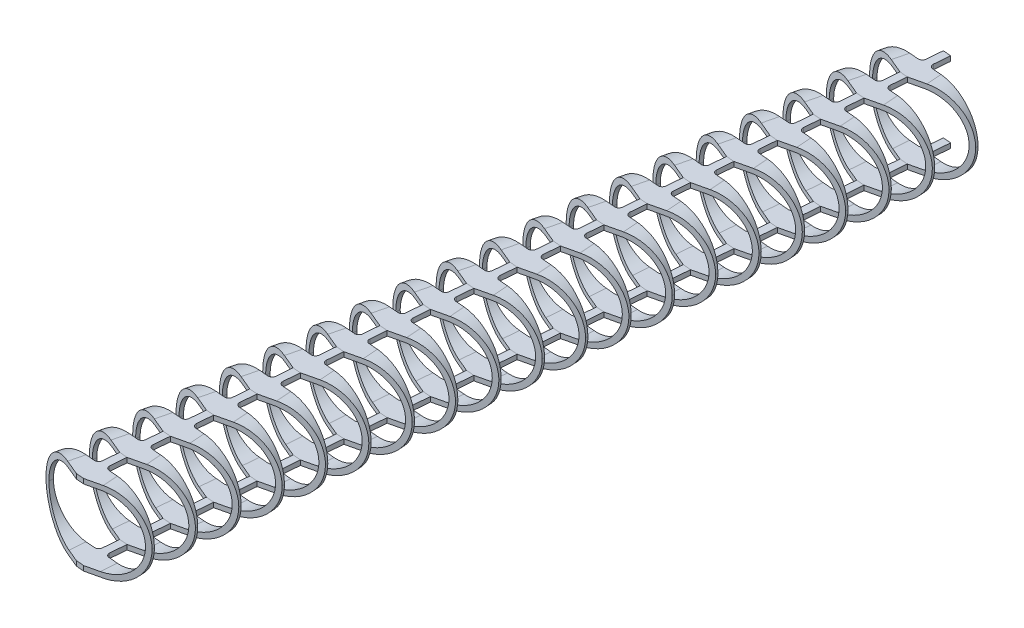
from build123d import *

# Parameters (mm, degrees)
BOSS_EXTRUDE2_DEPTH     = 100
FILLET1_R               = 50
FILLET2_R               = 5
CUT_EXTRUDE3_DEPTH      = 47
CUT_EXTRUDE3_DEPTH_BACK = 47


with BuildPart() as part:
    # Sketch1 → Boss-Extrude2 (new body)
    with BuildSketch(Plane(origin=(0, 0, 0), x_dir=(1, 0, 0), z_dir=(0, 1, 0))):
        Polygon((9.964685044, -0.839673725), (76.670367786, -6.460625001), (78.769552099, 18.45108761), (88.734237144, 17.611413885), (86.635052831, -7.300298727), (153.340735572, -12.921250003), (153.568968522, -16.041603582), (84.535868518, -32.212011338), (74.571183473, -31.372337613), (9.217505194, -3.87783419), align=None)
    extrude(amount=BOSS_EXTRUDE2_DEPTH)

    # Fillet1
    fillet1_edges = [part.edges().sort_by_distance(p)[0] for p in [
        (9.591095119, 100, 2.358753958),
        (9.591095119, 0, 2.358753958),
        (153.454852047, 0, 14.481426793),
        (153.454852047, 100, 14.481426793),
    ]]
    fillet(fillet1_edges, radius=FILLET1_R - 0.0001)  # a hair under: the kernel refuses the full size

    # Fillet2
    fillet2_edges = [part.edges().sort_by_distance(p)[0] for p in [
        (76.670367786, 50, 6.460625001),
        (86.635052831, 50, 7.300298727),
    ]]
    fillet(fillet2_edges, radius=FILLET2_R)

    # Sketch8 → Cut-Extrude3 (cut, two sides: drawn at the far end of the back side and taken through both)
    with BuildSketch(Plane(origin=(0, 0, 0), x_dir=(-0.9964685044458976, 0, -0.08396737251668822), z_dir=(0.0839673725166882, 0, -0.9964685044458975)).offset(-CUT_EXTRUDE3_DEPTH_BACK)):
        with BuildLine():
            Line((-97.942088429, 94), (-65.942088429, 94))
            Line((-65.942088429, 94), (-60.623256289, 94))
            add(Edge.make_bspline(
                [(-16, 50), (-16, 52.926041492), (-16.293067937, 55.802030794), (-17.153624772, 60.044121121), (-17.511165893, 61.446078496), (-18.155902612, 63.530496972), (-18.389598153, 64.224018155), (-18.89054481, 65.595442894), (-19.15724227, 66.272166778), (-20.570151831, 69.611784713), (-21.952353975, 72.143935669), (-23.991520358, 75.136595088), (-24.415065615, 75.726422228), (-25.294070354, 76.888395404), (-25.750621275, 77.461733141), (-27.154310816, 79.137437732), (-28.138647508, 80.200426953), (-31.232731054, 83.232036697), (-33.482219407, 85.044785033), (-36.53303245, 87.044184988), (-37.15508803, 87.43036015), (-38.409747221, 88.167493523), (-39.044010137, 88.519572374), (-40.967234395, 89.527212102), (-43.585932722, 90.74136702), (-46.31195503, 91.700299315), (-48.397318656, 92.322362259), (-49.099259648, 92.513498737), (-50.517032852, 92.862737564), (-51.231324108, 93.020379348), (-54.806133867, 93.719143346), (-57.698352456, 94), (-60.623256289, 94)],
                knots=[0, 0, 0, 0, 0.125, 0.125, 0.1875, 0.1875, 0.21875, 0.21875, 0.25, 0.25, 0.375, 0.375, 0.40625, 0.40625, 0.4375, 0.4375, 0.5, 0.5, 0.625, 0.625, 0.65625, 0.65625, 0.6875, 0.6875, 0.75, 0.8125, 0.8125, 0.84375, 0.84375, 0.875, 0.875, 1, 1, 1, 1], degree=3))
            add(Edge.make_bspline(
                [(-60.623256289, 6), (-57.697653963, 6), (-54.819774011, 6.280957922), (-50.571712744, 7.107200549), (-49.167235868, 7.450575557), (-46.381898734, 8.276364681), (-44.995554299, 8.761617774), (-40.957462182, 10.399299216), (-38.401578358, 11.736658457), (-34.770494916, 14.108306321), (-33.594157499, 14.960211244), (-31.312283198, 16.791697026), (-30.225902675, 17.755922661), (-27.126031935, 20.788869475), (-25.269968029, 22.996804785), (-22.809034218, 26.594189737), (-22.040725002, 27.846719473), (-20.647404803, 30.395192674), (-19.388758044, 32.997690333), (-18.394818823, 35.706375828), (-17.749793917, 37.778177403), (-17.551553624, 38.47550444), (-17.189179053, 39.883840196), (-17.024785307, 40.596154358), (-16.293253429, 44.177391354), (-16, 47.073212333), (-16, 50)],
                knots=[0, 0, 0, 0, 0.125, 0.125, 0.1875, 0.1875, 0.25, 0.25, 0.375, 0.375, 0.4375, 0.4375, 0.5, 0.5, 0.625, 0.625, 0.6875, 0.6875, 0.75, 0.8125, 0.8125, 0.84375, 0.84375, 0.875, 0.875, 1, 1, 1, 1], degree=3))
            Line((-60.623256289, 6), (-65.942088429, 6))
            Line((-65.942088429, 6), (-97.942088429, 6))
            Line((-97.942088429, 6), (-103.260920569, 6))
            add(Edge.make_bspline(
                [(-147.884176859, 50), (-147.884176859, 47.073958508), (-147.591108922, 44.197969206), (-146.730552087, 39.955878879), (-146.373010966, 38.553921504), (-145.728274247, 36.469503028), (-145.494578705, 35.775981845), (-144.993632048, 34.404557106), (-144.726934589, 33.727833222), (-143.314025028, 30.388215287), (-141.931822883, 27.856064331), (-139.892656501, 24.863404912), (-139.469111244, 24.273577772), (-138.590106505, 23.111604596), (-138.133555584, 22.538266859), (-136.729866043, 20.862562268), (-135.745529351, 19.799573047), (-132.651445804, 16.767963303), (-130.401957452, 14.955214967), (-127.351144409, 12.955815012), (-126.729088828, 12.56963985), (-125.474429637, 11.832506477), (-124.840166721, 11.480427626), (-122.916942464, 10.472787898), (-120.298244136, 9.25863298), (-117.572221828, 8.299700685), (-115.486858202, 7.677637741), (-114.784917211, 7.486501263), (-113.367144006, 7.137262436), (-112.652852751, 6.979620652), (-109.078042992, 6.280856654), (-106.185824403, 6), (-103.260920569, 6)],
                knots=[0, 0, 0, 0, 0.125, 0.125, 0.1875, 0.1875, 0.21875, 0.21875, 0.25, 0.25, 0.375, 0.375, 0.40625, 0.40625, 0.4375, 0.4375, 0.5, 0.5, 0.625, 0.625, 0.65625, 0.65625, 0.6875, 0.6875, 0.75, 0.8125, 0.8125, 0.84375, 0.84375, 0.875, 0.875, 1, 1, 1, 1], degree=3))
            add(Edge.make_bspline(
                [(-103.260920569, 94), (-106.186522895, 94), (-109.064402848, 93.719042078), (-113.312464115, 92.892799451), (-114.716940991, 92.549424443), (-117.502278125, 91.723635319), (-118.88862256, 91.238382226), (-122.926714677, 89.600700784), (-125.482598501, 88.263341543), (-129.113681942, 85.891693679), (-130.290019359, 85.039788756), (-132.571893661, 83.208302974), (-133.658274184, 82.244077339), (-136.758144924, 79.211130525), (-138.61420883, 77.003195215), (-141.075142641, 73.405810263), (-141.843451857, 72.153280527), (-143.236772056, 69.604807326), (-144.495418815, 67.002309667), (-145.489358036, 64.293624172), (-146.134382942, 62.221822597), (-146.332623235, 61.52449556), (-146.694997806, 60.116159804), (-146.859391552, 59.403845642), (-147.59092343, 55.822608646), (-147.884176859, 52.926787667), (-147.884176859, 50)],
                knots=[0, 0, 0, 0, 0.125, 0.125, 0.1875, 0.1875, 0.25, 0.25, 0.375, 0.375, 0.4375, 0.4375, 0.5, 0.5, 0.625, 0.625, 0.6875, 0.6875, 0.75, 0.8125, 0.8125, 0.84375, 0.84375, 0.875, 0.875, 1, 1, 1, 1], degree=3))
            Line((-103.260920569, 94), (-97.942088429, 94))
        make_face()
    extrude(amount=CUT_EXTRUDE3_DEPTH + CUT_EXTRUDE3_DEPTH_BACK, mode=Mode.SUBTRACT)


with BuildPart() as body_2:
    # LPattern2: read off the stored shape, not the designer's step
    # LPattern2: copy of part
    add(part.part.moved(Location((79.7690039, 0, -946.6450792))))


with BuildPart() as body_3:
    # LPattern2 2: copy of part
    add(part.part.moved(Location((75.5706353, 0, -896.821654))))


with BuildPart() as body_4:
    # LPattern2 3: copy of part
    add(part.part.moved(Location((71.3722666, 0, -846.9982288))))


with BuildPart() as body_5:
    # LPattern2 4: copy of part
    add(part.part.moved(Location((67.173898, 0, -797.1748036))))


with BuildPart() as body_6:
    # LPattern2 5: copy of part
    add(part.part.moved(Location((62.9755294, 0, -747.3513783))))


with BuildPart() as body_7:
    # LPattern2 6: copy of part
    add(part.part.moved(Location((58.7771608, 0, -697.5279531))))


with BuildPart() as body_8:
    # LPattern2 7: copy of part
    add(part.part.moved(Location((54.5787921, 0, -647.7045279))))


with BuildPart() as body_9:
    # LPattern2 8: copy of part
    add(part.part.moved(Location((50.3804235, 0, -597.8811027))))


with BuildPart() as body_10:
    # LPattern2 9: copy of part
    add(part.part.moved(Location((46.1820549, 0, -548.0576774))))


with BuildPart() as body_11:
    # LPattern2 10: copy of part
    add(part.part.moved(Location((41.9836863, 0, -498.2342522))))


with BuildPart() as body_12:
    # LPattern2 11: copy of part
    add(part.part.moved(Location((37.7853176, 0, -448.410827))))


with BuildPart() as body_13:
    # LPattern2 12: copy of part
    add(part.part.moved(Location((33.586949, 0, -398.5874018))))


with BuildPart() as body_14:
    # LPattern2 13: copy of part
    add(part.part.moved(Location((29.3885804, 0, -348.7639766))))


with BuildPart() as body_15:
    # LPattern2 14: copy of part
    add(part.part.moved(Location((25.1902118, 0, -298.9405513))))


with BuildPart() as body_16:
    # LPattern2 15: copy of part
    add(part.part.moved(Location((20.9918431, 0, -249.1171261))))


with BuildPart() as body_17:
    # LPattern2 16: copy of part
    add(part.part.moved(Location((16.7934745, 0, -199.2937009))))


with BuildPart() as body_18:
    # LPattern2 17: copy of part
    add(part.part.moved(Location((12.5951059, 0, -149.4702757))))


with BuildPart() as body_19:
    # LPattern2 18: copy of part
    add(part.part.moved(Location((8.3967373, 0, -99.6468504))))


with BuildPart() as body_20:
    # LPattern2 19: copy of part
    add(part.part.moved(Location((4.1983686, 0, -49.8234252))))


solid = Compound([part.part, body_2.part, body_3.part, body_4.part, body_5.part, body_6.part, body_7.part, body_8.part, body_9.part, body_10.part, body_11.part, body_12.part, body_13.part, body_14.part, body_15.part, body_16.part, body_17.part, body_18.part, body_19.part, body_20.part])
